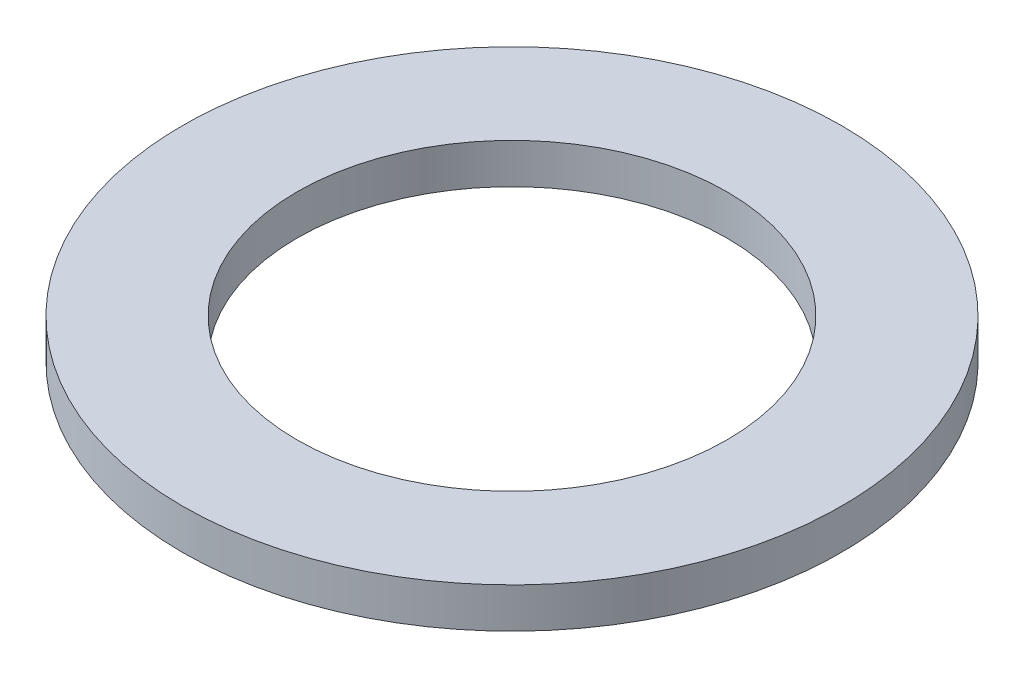
from build123d import *

# Parameters (mm, degrees)
SKETCH1_R           = 57.5
BOSS_EXTRUDE1_DEPTH = 7
SKETCH2_R           = 37.5
CUT_EXTRUDE1_DEPTH  = 82.618012718


with BuildPart() as part:
    # Sketch1 → Boss-Extrude1 (new body)
    with BuildSketch(Plane(origin=(0, 0, 0), x_dir=(1, 0, 0), z_dir=(0, 1, 0))):
        Circle(SKETCH1_R)
    extrude(amount=BOSS_EXTRUDE1_DEPTH)

    # Sketch2 → Cut-Extrude1 (cut, through all)
    with BuildSketch(Plane(origin=(0, 0, 0), x_dir=(1, 0, 0), z_dir=(0, 1, 0))):
        Circle(SKETCH2_R)
    extrude(amount=CUT_EXTRUDE1_DEPTH, mode=Mode.SUBTRACT)


solid = part.part
